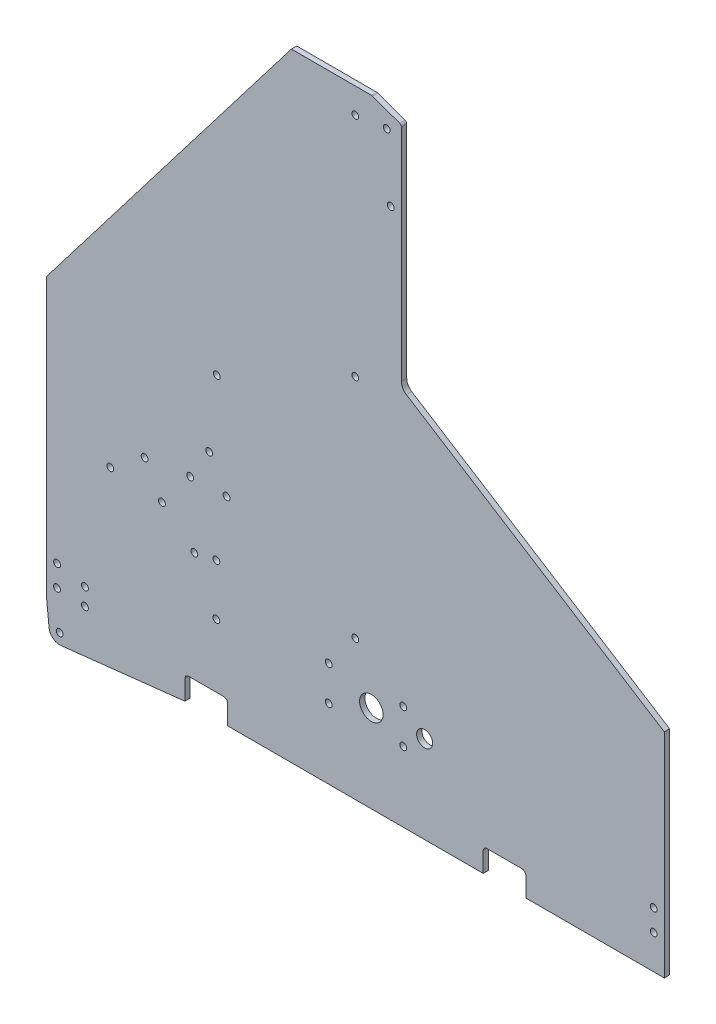
from build123d import *

# Parameters (mm, degrees)
SKETCH1_R           = 2.032
SKETCH1_R_2         = 2
BOSS_EXTRUDE1_DEPTH = 3.175
FILLET1_R           = 2.286
FILLET2_R           = 6.35
SKETCH2_R           = 2.032
CUT_EXTRUDE1_DEPTH  = 507.700158896
FILLET3_R           = 1.5875
SKETCH3_R           = 6.985
SKETCH3_R_2         = 2.032
SKETCH3_R_3         = 4.7625
CUT_EXTRUDE2_DEPTH  = 507.700158896


with BuildPart() as part:
    # Sketch1 → Boss-Extrude1 (new body)
    with BuildSketch(Plane.XY):
        with BuildLine():
            Line((8.639060666, -28.536126099), (82.55, -20.32))
            Line((82.55, -20.32), (82.55, -6.35))
            Line((82.55, -6.35), (107.95, -6.35))
            Line((107.95, -6.35), (107.95, -20.32))
            Line((107.95, -20.32), (260.35, -20.32))
            Line((260.35, -20.32), (260.35, -6.35))
            Line((260.35, -6.35), (285.75, -6.35))
            Line((285.75, -6.35), (285.75, -20.32))
            Line((285.75, -20.32), (368.3, -20.32))
            Line((368.3, -20.32), (368.3, 106.68))
            Line((368.3, 106.68), (211.61375, 205.74))
            Line((211.61375, 205.74), (211.61375, 341.63))
            Line((211.61375, 341.63), (194.14998, 347.98))
            Line((194.14998, 347.98), (184.15, 347.98))
            Line((184.15, 347.98), (146.05, 347.98))
            Line((146.05, 347.98), (0, 157.48))
            Line((0, 157.48), (0, 0))
            Line((0, 0), (0, -6.35))
            ThreePointArc((0, -6.35), (0.007883354, -6.666317007), (0.031513842, -6.981848616))
            Line((0.031513842, -6.981848616), (1.619013842, -22.856848616))
            ThreePointArc((1.619013842, -22.856848616), (3.943628298, -27.161748811), (8.639060666, -28.536126099))
        make_face()
        with Locations((7.9375, -22.225)):
            Circle(SKETCH1_R, mode=Mode.SUBTRACT)
        with Locations((6.35, 0)):
            Circle(SKETCH1_R, mode=Mode.SUBTRACT)
        with Locations((6.35, 12.7)):
            Circle(SKETCH1_R, mode=Mode.SUBTRACT)
        with Locations((88.216909404, 59.136578314)):
            Circle(SKETCH1_R, mode=Mode.SUBTRACT)
        with Locations((184.15, 62.98)):
            Circle(SKETCH1_R_2, mode=Mode.SUBTRACT)
        with Locations((38.1, 78.105)):
            Circle(SKETCH1_R, mode=Mode.SUBTRACT)
        with Locations((68.887329744, 75.518700365)):
            Circle(SKETCH1_R, mode=Mode.SUBTRACT)
        with Locations((58.568579744, 93.391299635)):
            Circle(SKETCH1_R, mode=Mode.SUBTRACT)
        with Locations((85.725, 97.155)):
            Circle(SKETCH1_R, mode=Mode.SUBTRACT)
        with Locations((107.382158942, 97.743700365)):
            Circle(SKETCH1_R, mode=Mode.SUBTRACT)
        with Locations((97.063408942, 115.616299635)):
            Circle(SKETCH1_R, mode=Mode.SUBTRACT)
        with Locations((101.6, 157.48)):
            Circle(SKETCH1_R, mode=Mode.SUBTRACT)
        with Locations((361.95, 0)):
            Circle(SKETCH1_R, mode=Mode.SUBTRACT)
        with Locations((361.95, 12.7)):
            Circle(SKETCH1_R, mode=Mode.SUBTRACT)
        with Locations((184.15, 197.98)):
            Circle(SKETCH1_R_2, mode=Mode.SUBTRACT)
        with Locations((184.15, 332.98)):
            Circle(SKETCH1_R_2, mode=Mode.SUBTRACT)
        with Locations((205.26375, 296.418)):
            Circle(SKETCH1_R, mode=Mode.SUBTRACT)
        with Locations((202.881865, 335.28)):
            Circle(SKETCH1_R_2, mode=Mode.SUBTRACT)
    extrude(amount=BOSS_EXTRUDE1_DEPTH)

    # Fillet1
    fillet1_edges = [part.edges().sort_by_distance(p)[0] for p in [
        (285.75, -6.35, 1.5875),
        (107.95, -6.35, 1.5875),
        (260.35, -6.35, 1.5875),
        (82.55, -6.35, 1.5875),
    ]]
    fillet(fillet1_edges, radius=FILLET1_R)

    # Fillet2
    fillet2_edges = [part.edges().sort_by_distance(p)[0] for p in [
        (211.61375, 205.74, 1.5875),
    ]]
    fillet(fillet2_edges, radius=FILLET2_R)

    # Sketch2 → Cut-Extrude1 (cut, through all)
    with BuildSketch(Plane(origin=(0, 0, 0), x_dir=(-1, 0, 0), z_dir=(0, 0, -1))):
        with Locations((-101.339768613, 61.847479268)):
            Circle(SKETCH2_R)
        with Locations((-101.339768613, 31.367479268)):
            Circle(SKETCH2_R)
        with Locations((-23.011998341, 8.96398506)):
            Circle(SKETCH2_R)
        with Locations((-23.011998341, -1.19601494)):
            Circle(SKETCH2_R)
    extrude(amount=-CUT_EXTRUDE1_DEPTH, mode=Mode.SUBTRACT)

    # Fillet3
    fillet3_edges = [part.edges().sort_by_distance(p)[0] for p in [
        (211.61375, 341.63, 1.5875),
        (194.14998, 347.98, 1.5875),
    ]]
    fillet(fillet3_edges, radius=FILLET3_R)

    # Sketch3 → Cut-Extrude2 (cut, through all)
    with BuildSketch(Plane.XY.offset(3.175)):
        with Locations((193.675, 31.75)):
            Circle(SKETCH3_R)
        with Locations((212.725, 42.06875)):
            Circle(SKETCH3_R_2)
        with Locations((212.725, 21.43125)):
            Circle(SKETCH3_R_2)
        with Locations((168.275, 21.43125)):
            Circle(SKETCH3_R_2)
        with Locations((168.275, 42.06875)):
            Circle(SKETCH3_R_2)
        with Locations((225.425, 31.75)):
            Circle(SKETCH3_R_3)
    extrude(amount=-CUT_EXTRUDE2_DEPTH, mode=Mode.SUBTRACT)


solid = part.part
